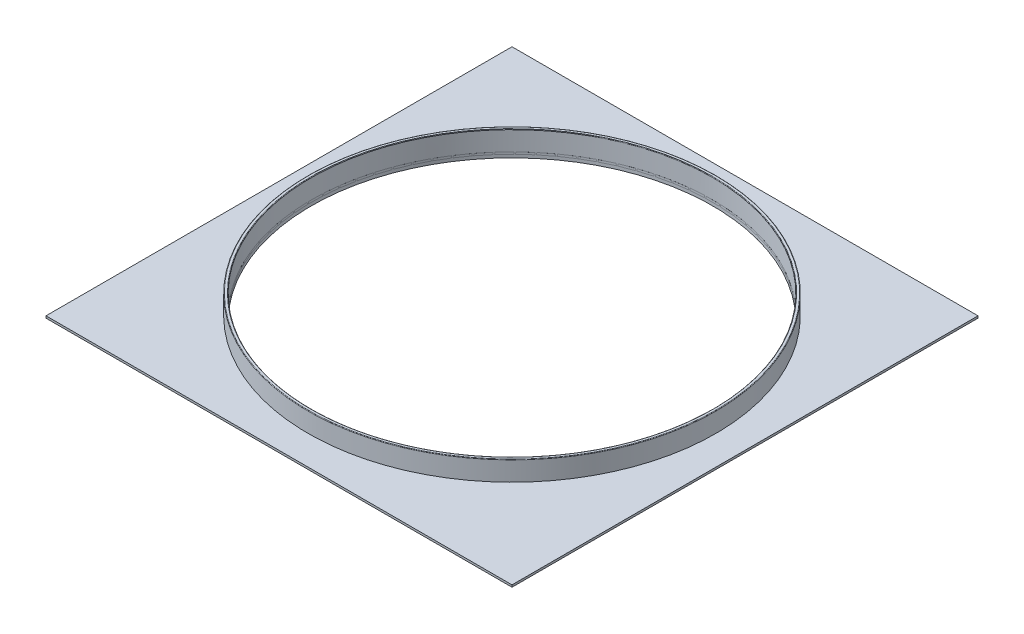
from build123d import *

# Parameters (mm, degrees)
FILLET3_R           = 0.79375
FILLET4_R           = 0.79375
SKETCH3_R           = 5.55625
CUT_EXTRUDE1_DEPTH  = 496.037891455
CIRPATTERN1_COUNT   = 12
SKETCH4_W           = 711.2
SKETCH4_H           = 711.2
SKETCH4_R           = 306.3875
BOSS_EXTRUDE1_DEPTH = 3.175


with BuildPart() as part:
    # Sketch1 → Revolve1 (revolve)
    with BuildSketch(Plane(origin=(0, 0, 0), x_dir=(0, 0, -1), z_dir=(1, 0, 0))):
        Polygon((306.3875, 0), (349.25, 0), (349.25, 4.7625), (311.15, 4.7625), (311.15, 38.1), (306.3875, 38.1), align=None)
    revolve(axis=Axis((0, 38.1, 0), (0, -1, 0)))

    # Fillet3
    fillet3_edges = [part.edges().sort_by_distance(p)[0] for p in [
        (0, 0, 349.25),
        (0, 4.7625, 349.25),
    ]]
    fillet(fillet3_edges, radius=FILLET3_R)

    # Fillet4
    fillet4_edges = [part.edges().sort_by_distance(p)[0] for p in [
        (0, 38.1, 311.15),
        (0, 4.7625, 311.15),
        (0, 38.1, 306.3875),
    ]]
    fillet(fillet4_edges, radius=FILLET4_R)

    # Sketch3 → Cut-Extrude1 (cut, through all)
    with BuildSketch(Plane(origin=(0, 4.7625, 0), x_dir=(-1, 0, 0), z_dir=(0, 1, 0))):
        with Locations((0, -328.6125)):
            Circle(SKETCH3_R)
    cut_extrude1 = extrude(amount=-CUT_EXTRUDE1_DEPTH, mode=Mode.SUBTRACT)

    # CirPattern1: Cut-Extrude1 ×12 about axis
    cirpattern1_axis = Axis((0, 38.1, 0), (0, 1, 0))
    for i in range(1, CIRPATTERN1_COUNT):
        add(cut_extrude1.rotate(cirpattern1_axis, i * 360 / CIRPATTERN1_COUNT), mode=Mode.SUBTRACT)


with BuildPart() as body_2:
    # Sketch4 → Boss-Extrude1 (new body)
    with BuildSketch(Plane(origin=(0, 4.7625, 0), x_dir=(1, 0, 0), z_dir=(0, 1, 0))):
        Rectangle(SKETCH4_W, SKETCH4_H)
        Circle(SKETCH4_R, mode=Mode.SUBTRACT)
    extrude(amount=BOSS_EXTRUDE1_DEPTH)


solid = Compound([part.part, body_2.part])
